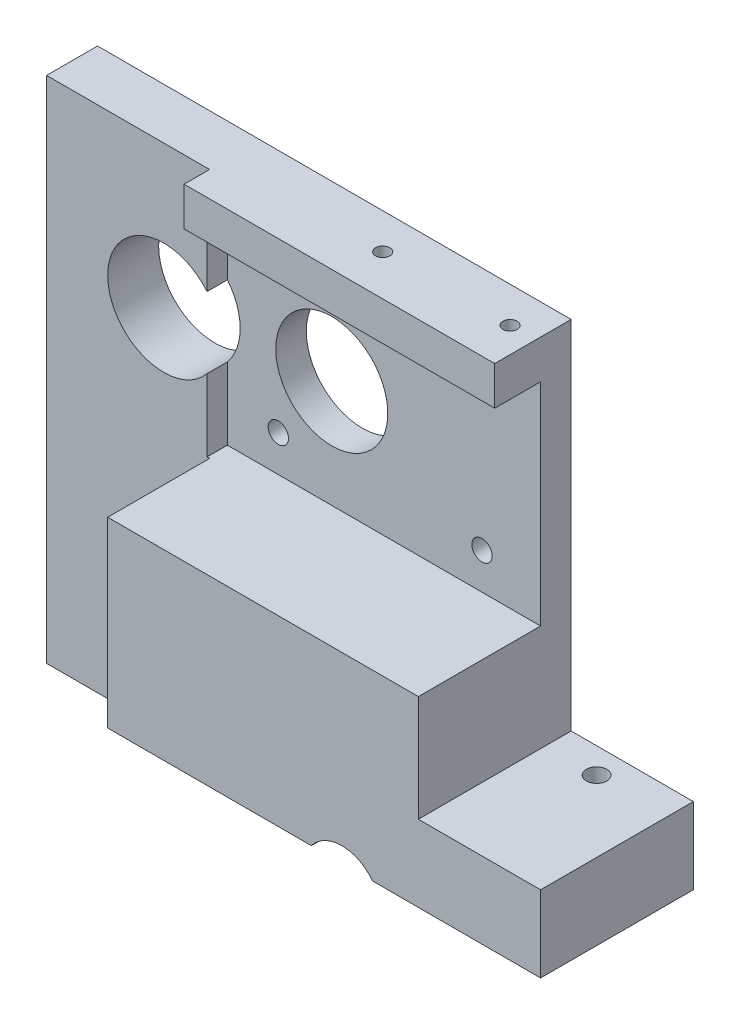
from build123d import *

# Parameters (mm, degrees)
SKETCH1_W                = 93
SKETCH1_H                = 100
BOSS_EXTRUDE2_DEPTH      = 10
SKETCH4_W                = 10.01
SKETCH4_H                = 15
BOSS_EXTRUDE4_DEPTH      = 24
SKETCH5_R                = 2
CUT_EXTRUDE1_DEPTH       = 50
SKETCH7_R                = 11
CUT_EXTRUDE3_DEPTH       = 50
SKETCH14_W               = 61.5
SKETCH14_H               = 42
CUT_EXTRUDE8_DEPTH       = 4
BOSS_EXTRUDE5_START      = -4
SKETCH16_W               = 61
SKETCH16_H               = 7.6
BOSS_EXTRUDE5_DEPTH      = 9
BOSS_EXTRUDE6_DEPTH      = 20
SKETCH19_R               = 11
CUT_EXTRUDE11_DEPTH      = 15
SKETCH20_R               = 2
CUT_EXTRUDE12_DEPTH      = 10
SKETCH8_R                = 1.4
CUT_EXTRUDE4_DEPTH       = 5.5
CUT_EXTRUDE13_DEPTH      = 103.078985596
CUT_EXTRUDE13_DEPTH_BACK = 103.078985596
SKETCH6_R                = 7.5


# Read off the part's stored shape, not the designer's step: Boss-Extrude6
with BuildPart() as part:
    # Sketch1 → Boss-Extrude2 (new body)
    with BuildSketch(Plane.XY):
        with Locations((-29.68705036, 14.928057554)):
            Rectangle(SKETCH1_W, SKETCH1_H)
    extrude(amount=BOSS_EXTRUDE2_DEPTH)

    # Sketch4 → Boss-Extrude4 (add)
    with BuildSketch(Plane(origin=(16.81294964, 0, 0), x_dir=(0, 0, -1), z_dir=(1, 0, 0))):
        with Locations((-4.995, -12.571942446)):
            Rectangle(SKETCH4_W, SKETCH4_H)
    extrude(amount=BOSS_EXTRUDE4_DEPTH)

    # Sketch5 → Cut-Extrude1 (cut)
    with BuildSketch(Plane(origin=(0, -5.071942446, 0), x_dir=(1, 0, 0), z_dir=(0, 1, 0))):
        with Locations(Location((26.81294964, -5, 0), (0, 0, 180))):
            Circle(SKETCH5_R)
    extrude(amount=-CUT_EXTRUDE1_DEPTH, mode=Mode.SUBTRACT)

    # Sketch7 → Cut-Extrude3 (cut)
    with BuildSketch(Plane(origin=(0, 0, 0), x_dir=(-1, 0, 0), z_dir=(0, 0, -1))):
        with Locations((24.18705036, 36.928057554)):
            Circle(SKETCH7_R)
    extrude(amount=-CUT_EXTRUDE3_DEPTH, mode=Mode.SUBTRACT)

    # Sketch14 → Cut-Extrude8 (cut)
    with BuildSketch(Plane.XY.offset(10)):
        with Locations((-13.93705036, 36.789132279)):
            Rectangle(SKETCH14_W, SKETCH14_H)
    extrude(amount=-CUT_EXTRUDE8_DEPTH, mode=Mode.SUBTRACT)

    # Sketch16 → Boss-Extrude5 (add)
    with BuildSketch(Plane.XY.offset(10).offset(BOSS_EXTRUDE5_START)):
        with Locations((-13.68705036, 61.128057554)):
            Rectangle(SKETCH16_W, SKETCH16_H)
    extrude(amount=BOSS_EXTRUDE5_DEPTH)

    # Boss-Extrude6 outline → Boss-Extrude6 (add)
    with BuildSketch(Plane.XY.offset(10)):
        Polygon((40.81294964, -5.071942446), (16.81294964, -5.071942446), (16.81294964, 15.789132279), (-44.18705036, 15.789132279), (-44.18705036, -20.071942446), (40.81294964, -20.071942446), align=None)
    extrude(amount=BOSS_EXTRUDE6_DEPTH)

    # Sketch19 → Cut-Extrude11 (cut)
    with BuildSketch(Plane(origin=(0, 0, 0), x_dir=(-1, 0, 0), z_dir=(0, 0, -1))):
        with Locations((53.18705036, 36.928057554)):
            Circle(SKETCH19_R)
    extrude(amount=-CUT_EXTRUDE11_DEPTH, mode=Mode.SUBTRACT)

    # Sketch20 → Cut-Extrude12 (cut)
    with BuildSketch(Plane.XY.offset(6)):
        with Locations((-34.68705036, 50.928057554)):
            Circle(SKETCH20_R)
        with Locations((5.31294964, 50.928057554)):
            Circle(SKETCH20_R)
        with Locations((-34.68705036, 22.928057554)):
            Circle(SKETCH20_R)
        with Locations((5.31294964, 22.928057554)):
            Circle(SKETCH20_R)
    extrude(amount=-CUT_EXTRUDE12_DEPTH, mode=Mode.SUBTRACT)

    # Sketch8 → Cut-Extrude4 (cut)
    with BuildSketch(Plane(origin=(0, 64.928057554, 0), x_dir=(1, 0, 0), z_dir=(0, 1, 0))):
        with Locations(Location((-13.18705036, -7, 0), (0, 0, 270))):
            Circle(SKETCH8_R)
        with Locations(Location((11.81294964, -7, 0), (0, 0, 270))):
            Circle(SKETCH8_R)
    extrude(amount=-CUT_EXTRUDE4_DEPTH, mode=Mode.SUBTRACT)

    # Sketch6 → Cut-Extrude13 (cut, two sides: drawn at the far end of the back side and taken through both)
    with BuildSketch(Plane(origin=(0, 0, 10), x_dir=(-1, 0, 0), z_dir=(0, 0, -1)).offset(-CUT_EXTRUDE13_DEPTH_BACK)):
        with Locations(Location((-1.81294964, -24.571942446, 0), (0, 0, 180))):
            Circle(SKETCH6_R)
    extrude(amount=CUT_EXTRUDE13_DEPTH + CUT_EXTRUDE13_DEPTH_BACK, mode=Mode.SUBTRACT)


solid = part.part
